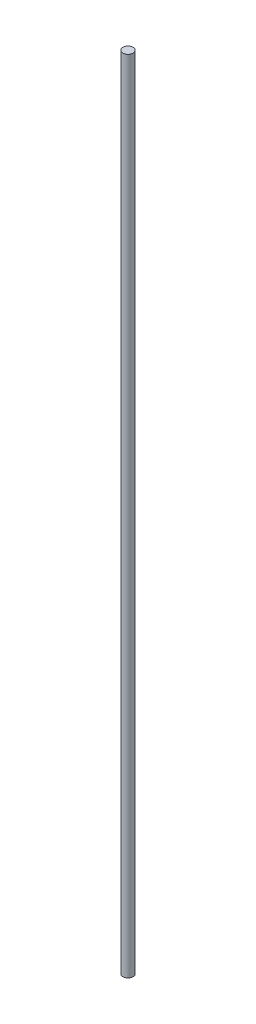
from build123d import *

# Parameters (mm, degrees)
SKETCH1_R           = 1.5
BOSS_EXTRUDE1_DEPTH = 235


with BuildPart() as part:
    # Sketch1 → Boss-Extrude1 (new body)
    with BuildSketch(Plane(origin=(0, 0, 0), x_dir=(1, 0, 0), z_dir=(0, 1, 0))):
        Circle(SKETCH1_R)
    extrude(amount=BOSS_EXTRUDE1_DEPTH)


solid = part.part
